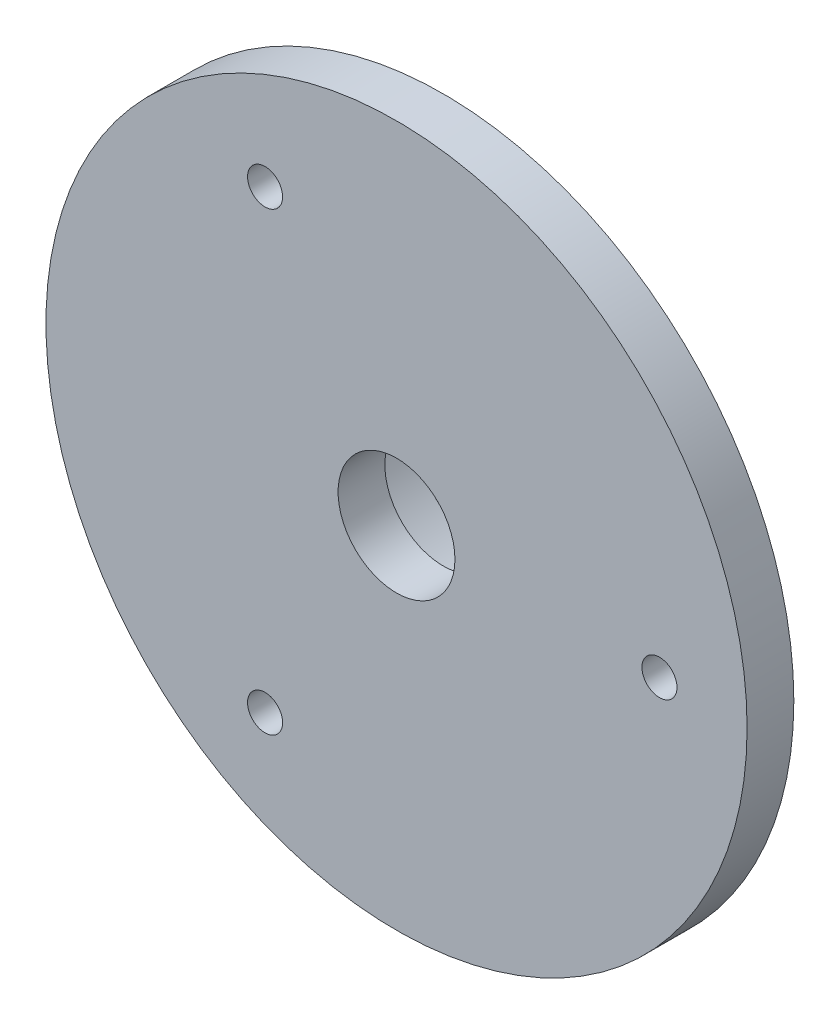
from build123d import *

# Parameters (mm, degrees)
SKETCH1_R           = 30
SKETCH1_R_2         = 5
SKETCH1_R_3         = 1.5
BOSS_EXTRUDE1_DEPTH = 4
SKETCH2_R           = 16
SKETCH2_R_2         = 12
BOSS_EXTRUDE2_DEPTH = 8


with BuildPart() as part:
    # Sketch1 → Boss-Extrude1 (new body)
    with BuildSketch(Plane.XY):
        Circle(SKETCH1_R)
        Circle(SKETCH1_R_2, mode=Mode.SUBTRACT)
        with Locations((22.5, 0)):
            Circle(SKETCH1_R_3, mode=Mode.SUBTRACT)
        with Locations((-11.25, -19.485571585)):
            Circle(SKETCH1_R_3, mode=Mode.SUBTRACT)
        with Locations((-11.25, 19.485571585)):
            Circle(SKETCH1_R_3, mode=Mode.SUBTRACT)
    extrude(amount=BOSS_EXTRUDE1_DEPTH)

    # Sketch2 → Boss-Extrude2 (add)
    with BuildSketch(Plane(origin=(0, 0, 0), x_dir=(-1, 0, 0), z_dir=(0, 0, -1))):
        Circle(SKETCH2_R)
        Circle(SKETCH2_R_2, mode=Mode.SUBTRACT)
    extrude(amount=BOSS_EXTRUDE2_DEPTH)


solid = part.part
